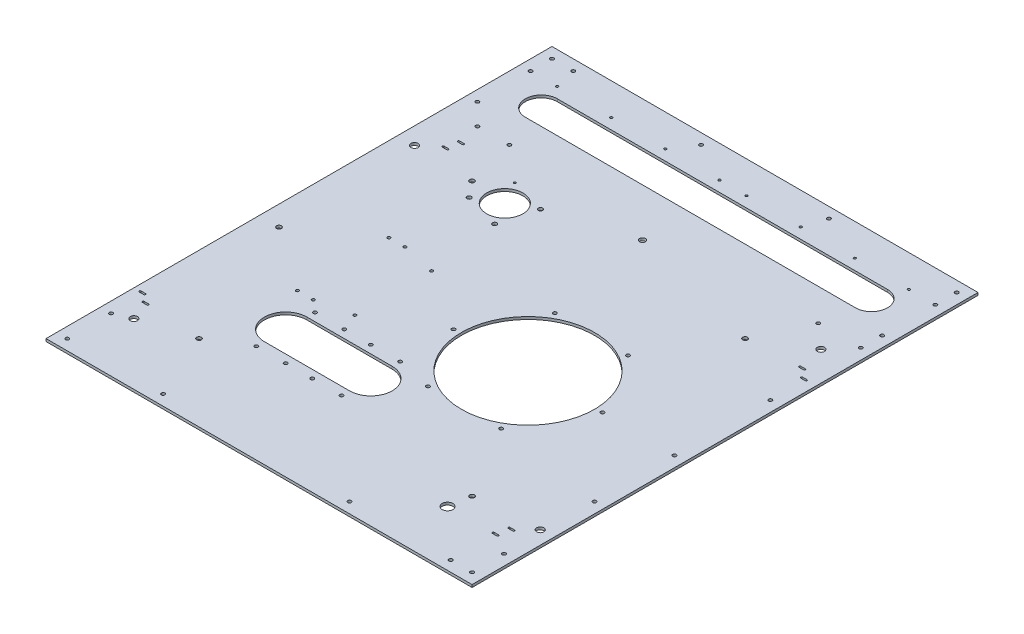
from build123d import *

# Parameters (mm, degrees)
SKETCH1_W                 = 800
SKETCH1_H                 = 800
BOSS_EXTRUDE1_DEPTH       = 4.826
SKETCH2_R                 = 125
CUT_EXTRUDE1_DEPTH        = 566.706010465
CUT_EXTRUDE2_DEPTH        = 566.706010465
SKETCH5_R                 = 34
CUT_EXTRUDE3_DEPTH        = 10
SKETCH6_R                 = 10
CUT_EXTRUDE4_DEPTH        = 10
F_8_0MM_DOWEL_HOLE1_D     = 8
F_8_0MM_DOWEL_HOLE1_DEPTH = 10.71
F_8_0MM_DOWEL_HOLE1_TIP   = 2.403442476
M5X0_8_TAPPED_HOLE1_D     = 4.2
M5X0_8_TAPPED_HOLE1_DEPTH = 12.4
M5X0_8_TAPPED_HOLE1_TIP   = 1.2618073
SKETCH13_W                = 800
SKETCH13_H                = 4.826
BOSS_EXTRUDE4_DEPTH       = 150
SKETCH30_R                = 5.5
CUT_EXTRUDE8_DEPTH        = 10
M4_CLEARANCE_HOLE2_D      = 4.5
M4_CLEARANCE_HOLE2_DEPTH  = 19.75
M4_CLEARANCE_HOLE2_TIP    = 1.351936393
M6_CLEARANCE_HOLE5_D      = 6.6
M6_CLEARANCE_HOLE5_DEPTH  = 19.75
M6_CLEARANCE_HOLE5_TIP    = 1.982840043
M5_CLEARANCE_HOLE2_D      = 5.5
M5_CLEARANCE_HOLE2_DEPTH  = 19.75
M5_CLEARANCE_HOLE2_TIP    = 1.652366702
M8_CLEARANCE_HOLE1_D      = 9
M8_CLEARANCE_HOLE1_DEPTH  = 19.75
M8_CLEARANCE_HOLE1_TIP    = 2.703872786
M6_CLEARANCE_HOLE2_D      = 6.6
M6_CLEARANCE_HOLE2_DEPTH  = 19.75
M6_CLEARANCE_HOLE2_TIP    = 1.982840043
M3_CLEARANCE_SLOT1_DEPTH  = 4.826
M12_CLEARANCE_HOLE1_D     = 13.5
M12_CLEARANCE_HOLE1_DEPTH = 19.75
M12_CLEARANCE_HOLE1_TIP   = 4.055809178
M6_CLEARANCE_HOLE4_D      = 6.6
M6_CLEARANCE_HOLE4_DEPTH  = 19.75
M6_CLEARANCE_HOLE4_TIP    = 1.982840043


# Read off the part's stored shape, not the designer's step: M3 Clearance Slot1
with BuildPart() as part:
    # Sketch1 → Boss-Extrude1 (new body)
    with BuildSketch(Plane(origin=(0, 0, 0), x_dir=(1, 0, 0), z_dir=(0, 1, 0))):
        Rectangle(SKETCH1_W, SKETCH1_H)
    extrude(amount=BOSS_EXTRUDE1_DEPTH)

    # Sketch2 → Cut-Extrude1 (cut, through all)
    with BuildSketch(Plane(origin=(0, 4.826, 0), x_dir=(1, 0, 0), z_dir=(0, 1, 0))):
        with Locations(Location((105, 0, 0), (0, 0, 270))):
            Circle(SKETCH2_R)
    extrude(amount=-CUT_EXTRUDE1_DEPTH, mode=Mode.SUBTRACT)

    # Sketch4 → Cut-Extrude2 (cut, through all)
    with BuildSketch(Plane(origin=(0, 0, 0), x_dir=(-1, 0, 0), z_dir=(0, -1, 0))):
        with BuildLine():
            Line((30, -120), (190, -120))
            ThreePointArc((190, -120), (230, -160), (190, -200))
            Line((190, -200), (30, -200))
            ThreePointArc((30, -200), (-10, -160), (30, -120))
        make_face()
    extrude(amount=-CUT_EXTRUDE2_DEPTH, mode=Mode.SUBTRACT)

    # Sketch5 → Cut-Extrude3 (cut)
    with BuildSketch(Plane(origin=(0, 4.826, 0), x_dir=(1, 0, 0), z_dir=(0, 1, 0))):
        with Locations(Location((-189.15620239, 250.631065707, 0), (0, 0, 270))):
            Circle(SKETCH5_R)
    extrude(amount=-CUT_EXTRUDE3_DEPTH, mode=Mode.SUBTRACT)

    # Sketch6 → Cut-Extrude4 (cut)
    with BuildSketch(Plane.XZ):
        with Locations(Location((250, 296.067982058, 0), (0, 0, 270))):
            Circle(SKETCH6_R)
    extrude(amount=-CUT_EXTRUDE4_DEPTH, mode=Mode.SUBTRACT)

    # Ø8.0mm Dowel Hole1
    with Locations(Plane(origin=(0, 4.826, 0), x_dir=(1, 0, 0), z_dir=(0, 1, 0))):
        with Locations((-232.122235486, 226.631065707), (-146.190169294, 274.631065707), (-165.15620239, 207.665032611)):
            Hole(F_8_0MM_DOWEL_HOLE1_D / 2, depth=F_8_0MM_DOWEL_HOLE1_DEPTH)
            with Locations((0, 0, -(F_8_0MM_DOWEL_HOLE1_DEPTH + F_8_0MM_DOWEL_HOLE1_TIP / 2))):  # 118° drill point
                Cone(0, F_8_0MM_DOWEL_HOLE1_D / 2, F_8_0MM_DOWEL_HOLE1_TIP, mode=Mode.SUBTRACT)

    # M5x0.8 Tapped Hole1
    with Locations(Plane(origin=(0, 4.826, 0), x_dir=(1, 0, 0), z_dir=(0, 1, 0))):
        with Locations((-213.15620239, 293.597098803)):
            Hole(M5X0_8_TAPPED_HOLE1_D / 2, depth=M5X0_8_TAPPED_HOLE1_DEPTH)
            with Locations((0, 0, -(M5X0_8_TAPPED_HOLE1_DEPTH + M5X0_8_TAPPED_HOLE1_TIP / 2))):  # 118° drill point
                Cone(0, M5X0_8_TAPPED_HOLE1_D / 2, M5X0_8_TAPPED_HOLE1_TIP, mode=Mode.SUBTRACT)

    # Sketch13 → Boss-Extrude4 (add)
    with BuildSketch(Plane(origin=(1600, 0, -400), x_dir=(1, 0, 0), z_dir=(0, 0, 1))):
        with Locations((-1600, 2.413)):
            Rectangle(SKETCH13_W, SKETCH13_H)
    extrude(amount=-BOSS_EXTRUDE4_DEPTH)

    # Sketch30 → Cut-Extrude8 (cut)
    with BuildSketch(Plane(origin=(0, 4.826, 0), x_dir=(1, 0, 0), z_dir=(0, 1, 0))):
        with Locations(Location((0, 320, 0), (0, 0, 270))):
            Circle(SKETCH30_R)
        with BuildLine():
            Line((310, 410), (-310, 410))
            ThreePointArc((-310, 410), (-340, 440), (-310, 470))
            Line((-310, 470), (310, 470))
            ThreePointArc((310, 470), (340, 440), (310, 410))
        make_face()
    extrude(amount=-CUT_EXTRUDE8_DEPTH, mode=Mode.SUBTRACT)

    # M4 Clearance Hole2
    with Locations(Plane(origin=(0, 4.826, 0), x_dir=(1, 0, 0), z_dir=(0, 1, 0))):
        with Locations((-330.2, 490), (330.2, 490), (228.6, 490), (127, 490), (25.4, 490), (-25.4, 490), (-127, 490), (-228.6, 490)):
            Hole(M4_CLEARANCE_HOLE2_D / 2, depth=M4_CLEARANCE_HOLE2_DEPTH)
            with Locations((0, 0, -(M4_CLEARANCE_HOLE2_DEPTH + M4_CLEARANCE_HOLE2_TIP / 2))):  # 118° drill point
                Cone(0, M4_CLEARANCE_HOLE2_D / 2, M4_CLEARANCE_HOLE2_TIP, mode=Mode.SUBTRACT)

    # M6 Clearance Hole5
    with Locations(Plane(origin=(0, 4.826, 0), x_dir=(1, 0, 0), z_dir=(0, 1, 0))):
        with Locations((-190, -215), (-30, -215), (-190, -105), (-30, -105), (-135, -215), (-85, -215), (-85, -105), (-135, -105)):
            Hole(M6_CLEARANCE_HOLE5_D / 2, depth=M6_CLEARANCE_HOLE5_DEPTH)
            with Locations((0, 0, -(M6_CLEARANCE_HOLE5_DEPTH + M6_CLEARANCE_HOLE5_TIP / 2))):  # 118° drill point
                Cone(0, M6_CLEARANCE_HOLE5_D / 2, M6_CLEARANCE_HOLE5_TIP, mode=Mode.SUBTRACT)

    # M5 Clearance Hole2
    with Locations(Plane(origin=(0, 4.826, 0), x_dir=(1, 0, 0), z_dir=(0, 1, 0))):
        with Locations((-242.136236567, -86), (-212.136236567, -86), (-148.136236567, -72), (-148.136236567, 72), (-212.136236567, 86), (-242.136236567, 86)):
            Hole(M5_CLEARANCE_HOLE2_D / 2, depth=M5_CLEARANCE_HOLE2_DEPTH)
            with Locations((0, 0, -(M5_CLEARANCE_HOLE2_DEPTH + M5_CLEARANCE_HOLE2_TIP / 2))):  # 118° drill point
                Cone(0, M5_CLEARANCE_HOLE2_D / 2, M5_CLEARANCE_HOLE2_TIP, mode=Mode.SUBTRACT)

    # M8 Clearance Hole1
    with Locations(Plane(origin=(0, 4.826, 0), x_dir=(1, 0, 0), z_dir=(0, 1, 0))):
        with Locations((-256.32620818, 256.32620818), (-362.5, 0), (-256.32620818, -256.32620818), (256.32620818, -256.32620818), (256.32620818, 256.32620818)):
            Hole(M8_CLEARANCE_HOLE1_D / 2, depth=M8_CLEARANCE_HOLE1_DEPTH)
            with Locations((0, 0, -(M8_CLEARANCE_HOLE1_DEPTH + M8_CLEARANCE_HOLE1_TIP / 2))):  # 118° drill point
                Cone(0, M8_CLEARANCE_HOLE1_D / 2, M8_CLEARANCE_HOLE1_TIP, mode=Mode.SUBTRACT)

    # M6 Clearance Hole2
    with Locations(Plane(origin=(0, 4.826, 0), x_dir=(1, 0, 0), z_dir=(0, 1, 0))):
        with Locations((173.75, -119.07849302), (105, 0), (36.25, -119.07849302), (-32.479946748, -2.34824234), (36.25, 119.07849302), (173.75, 119.07849302), (242.479946748, 2.34824234)):
            Hole(M6_CLEARANCE_HOLE2_D / 2, depth=M6_CLEARANCE_HOLE2_DEPTH)
            with Locations((0, 0, -(M6_CLEARANCE_HOLE2_DEPTH + M6_CLEARANCE_HOLE2_TIP / 2))):  # 118° drill point
                Cone(0, M6_CLEARANCE_HOLE2_D / 2, M6_CLEARANCE_HOLE2_TIP, mode=Mode.SUBTRACT)

    # M3 Clearance Slot1 outline → M3 Clearance Slot1 (cut)
    with BuildSketch(Plane(origin=(0, 0, 0), x_dir=(1, 0, 0), z_dir=(0, 1, 0))):
        with BuildLine():
            Line((342.7, -274.7), (351.3, -274.7))
            ThreePointArc((351.3, -274.7), (353, -273), (351.3, -271.3))
            Line((351.3, -271.3), (342.7, -271.3))
            ThreePointArc((342.7, -271.3), (341, -273), (342.7, -274.7))
        make_face()
        with BuildLine():
            Line((335.7, -297.7), (344.3, -297.7))
            ThreePointArc((344.3, -297.7), (346, -296), (344.3, -294.3))
            Line((344.3, -294.3), (335.7, -294.3))
            ThreePointArc((335.7, -294.3), (334, -296), (335.7, -297.7))
        make_face()
        with BuildLine():
            Line((353.7, 260.3), (362.3, 260.3))
            ThreePointArc((362.3, 260.3), (364, 262), (362.3, 263.7))
            Line((362.3, 263.7), (353.7, 263.7))
            ThreePointArc((353.7, 263.7), (352, 262), (353.7, 260.3))
        make_face()
        with BuildLine():
            Line((372.7, 244.3), (381.3, 244.3))
            ThreePointArc((381.3, 244.3), (383, 246), (381.3, 247.7))
            Line((381.3, 247.7), (372.7, 247.7))
            ThreePointArc((372.7, 247.7), (371, 246), (372.7, 244.3))
        make_face()
        with BuildLine():
            Line((-339.3, 283.3), (-330.7, 283.3))
            ThreePointArc((-330.7, 283.3), (-329, 285), (-330.7, 286.7))
            Line((-330.7, 286.7), (-339.3, 286.7))
            ThreePointArc((-339.3, 286.7), (-341, 285), (-339.3, 283.3))
        make_face()
        with BuildLine():
            Line((-333.3, 306.3), (-324.7, 306.3))
            ThreePointArc((-324.7, 306.3), (-323, 308), (-324.7, 309.7))
            Line((-324.7, 309.7), (-333.3, 309.7))
            ThreePointArc((-333.3, 309.7), (-335, 308), (-333.3, 306.3))
        make_face()
        with BuildLine():
            Line((-388.3, -236.7), (-379.7, -236.7))
            ThreePointArc((-379.7, -236.7), (-378, -235), (-379.7, -233.3))
            Line((-379.7, -233.3), (-388.3, -233.3))
            ThreePointArc((-388.3, -233.3), (-390, -235), (-388.3, -236.7))
        make_face()
        with BuildLine():
            Line((-368.3, -250.7), (-359.7, -250.7))
            ThreePointArc((-359.7, -250.7), (-358, -249), (-359.7, -247.3))
            Line((-359.7, -247.3), (-368.3, -247.3))
            ThreePointArc((-368.3, -247.3), (-370, -249), (-368.3, -250.7))
        make_face()
    extrude(amount=M3_CLEARANCE_SLOT1_DEPTH, mode=Mode.SUBTRACT)

    # M12 Clearance Hole1
    with Locations(Plane(origin=(0, 4.826, 0), x_dir=(1, 0, 0), z_dir=(0, 1, 0))):
        with Locations((-368, 260), (345, 310), (375, -247), (-350, -285)):
            Hole(M12_CLEARANCE_HOLE1_D / 2, depth=M12_CLEARANCE_HOLE1_DEPTH)
            with Locations((0, 0, -(M12_CLEARANCE_HOLE1_DEPTH + M12_CLEARANCE_HOLE1_TIP / 2))):  # 118° drill point
                Cone(0, M12_CLEARANCE_HOLE1_D / 2, M12_CLEARANCE_HOLE1_TIP, mode=Mode.SUBTRACT)

    # M6 Clearance Hole4
    with Locations(Plane(origin=(0, 4.826, 0), x_dir=(1, 0, 0), z_dir=(0, 1, 0))):
        with Locations((-340, 350), (380, 530), (140, 530), (-100, 530), (-340, 530), (-380, 530), (-380, 490), (-380, 390), (-380, -297.902127426), (380, 490), (380, 390), (380, 180), (380, -150), (380, 0), (380, -320), (380, -380), (340, -380.12066422), (150, -380.12066422), (-200, -380.12066422), (-380, -380.12066422), (-280, 350), (380, 350), (300, 350)):
            Hole(M6_CLEARANCE_HOLE4_D / 2, depth=M6_CLEARANCE_HOLE4_DEPTH)
            with Locations((0, 0, -(M6_CLEARANCE_HOLE4_DEPTH + M6_CLEARANCE_HOLE4_TIP / 2))):  # 118° drill point
                Cone(0, M6_CLEARANCE_HOLE4_D / 2, M6_CLEARANCE_HOLE4_TIP, mode=Mode.SUBTRACT)


solid = part.part
